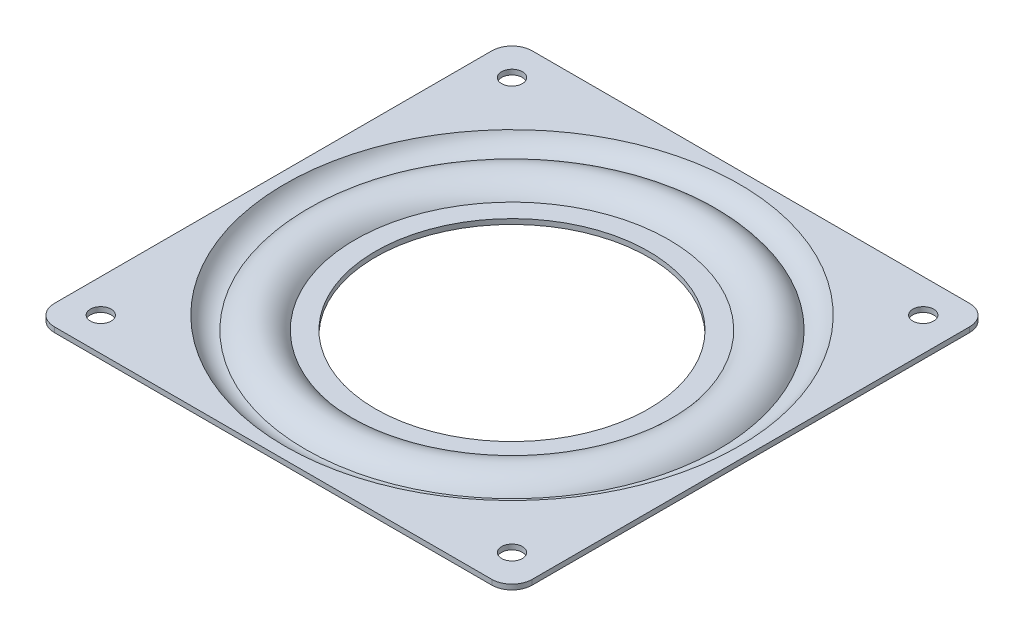
from build123d import *

# Parameters (mm, degrees)
SKETCH_2_R      = 2.05
SKETCH_2_R_2    = 44.910539349
EXTRUDE_1_DEPTH = 1


with BuildPart() as part:
    # 草图1 → 旋转1 (revolve)
    with BuildSketch(Plane.XY):
        with BuildLine():
            ThreePointArc((-31, -2.569785971), (-33.146193621, -0.681105182), (-35.922766673, 0))
            ThreePointArc((-35.922766673, 0), (-36.36897393, -0.016614747), (-36.812709979, -0.066366972))
            ThreePointArc((-36.812709979, -0.066366972), (-39.087205959, -0.902321705), (-40.845533346, -2.569785971))
            ThreePointArc((-40.845533346, -2.569785971), (-43.250116145, -1.873465974), (-44.910539349, 0))
            Line((-44.910539349, 0), (-45.813874016, -0.428936451))
            ThreePointArc((-45.813874016, -0.428936451), (-43.539426354, -2.86488143), (-40.275857757, -3.540203663))
            ThreePointArc((-40.275857757, -3.540203663), (-35.905809817, -1.000028754), (-31.553091654, -3.569785971))
            Line((-31.553091654, -3.569785971), (-27, -3.569785971))
            Line((-27, -3.569785971), (-27, -2.569785971))
            Line((-27, -2.569785971), (-31, -2.569785971))
        make_face()
    revolve(axis=Axis((0, 6.917160425, 0), (0, -1, 0)))

    # 草图2 → 凸台-拉伸1 (add)
    with BuildSketch(Plane(origin=(0, 0, 0), x_dir=(1, 0, 0), z_dir=(0, 1, 0))):
        with BuildLine():
            Line((43.25, 47.25), (-43.25, 47.25))
            ThreePointArc((-43.25, 47.25), (-46.078427125, 46.078427125), (-47.25, 43.25))
            Line((-47.25, 43.25), (-47.25, -43.25))
            ThreePointArc((-47.25, -43.25), (-46.078427125, -46.078427125), (-43.25, -47.25))
            Line((-43.25, -47.25), (43.25, -47.25))
            ThreePointArc((43.25, -47.25), (46.078427125, -46.078427125), (47.25, -43.25))
            Line((47.25, -43.25), (47.25, 43.25))
            ThreePointArc((47.25, 43.25), (46.078427125, 46.078427125), (43.25, 47.25))
        make_face()
        with Locations((-40.658639918, -40.658639918)):
            Circle(SKETCH_2_R, mode=Mode.SUBTRACT)
        with Locations((40.658639918, -40.658639918)):
            Circle(SKETCH_2_R, mode=Mode.SUBTRACT)
        with Locations((-40.658639918, 40.658639918)):
            Circle(SKETCH_2_R, mode=Mode.SUBTRACT)
        Circle(SKETCH_2_R_2, mode=Mode.SUBTRACT)
        with Locations((40.658639918, 40.658639918)):
            Circle(SKETCH_2_R, mode=Mode.SUBTRACT)
    extrude(amount=-EXTRUDE_1_DEPTH)


solid = part.part
